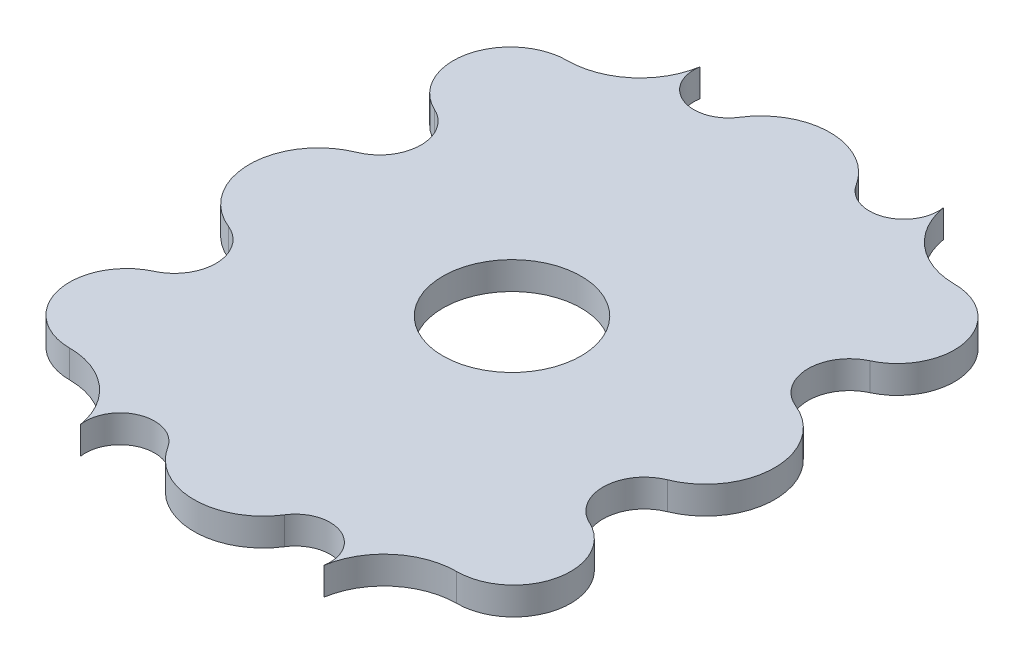
from build123d import *

# Parameters (mm, degrees)
SALIENTE_EXTRUIR1_DEPTH = 10
SALIENTE_EXTRUIR2_DEPTH = 10
CROQUIS3_R              = 25
CORTAR_EXTRUIR1_DEPTH   = 10


with BuildPart() as part:
    # Croquis1 → Saliente-Extruir1 (new body)
    with BuildSketch(Plane(origin=(0, 0, 0), x_dir=(1, 0, 0), z_dir=(0, 1, 0))):
        with BuildLine():
            Line((-70, -90), (-70, 90))
            ThreePointArc((-70, 90), (-52.983030462, 96.249658661), (-44.055908755, 112.027554074))
            ThreePointArc((-44.055908755, 112.027554074), (-36.156795126, 98.313355526), (-21.147629234, 103.333333333))
            ThreePointArc((-21.147629234, 103.333333333), (0, 115), (21.147629234, 103.333333333))
            ThreePointArc((21.147629234, 103.333333333), (36.156795126, 98.313355526), (44.055908755, 112.027554074))
            ThreePointArc((44.055908755, 112.027554074), (52.983030462, 96.249658661), (70, 90))
            Line((70, 90), (70, -90))
            ThreePointArc((70, -90), (52.983030462, -96.249658661), (44.055908755, -112.027554074))
            ThreePointArc((44.055908755, -112.027554074), (36.156795126, -98.313355526), (21.147629234, -103.333333333))
            ThreePointArc((21.147629234, -103.333333333), (0, -115), (-21.147629234, -103.333333333))
            ThreePointArc((-21.147629234, -103.333333333), (-36.156795126, -98.313355526), (-44.055908755, -112.027554074))
            ThreePointArc((-44.055908755, -112.027554074), (-52.983030462, -96.249658661), (-70, -90))
        make_face()
    extrude(amount=SALIENTE_EXTRUIR1_DEPTH)

    # Croquis2 → Saliente-Extruir2 (add)
    with BuildSketch(Plane(origin=(0, 10, 0), x_dir=(1, 0, 0), z_dir=(0, 1, 0))):
        with BuildLine():
            ThreePointArc((78.682594762, 50.68578538), (90.130790614, 73.830022537), (70, 90))
            Line((70, 90), (70, 37.080992462))
            ThreePointArc((70, 37.080992462), (72.355612347, 45.150655433), (78.682594762, 50.68578538))
        make_face()
        with BuildLine():
            ThreePointArc((78.682594762, -50.68578538), (72.355612347, -45.150655433), (70, -37.080992462))
            Line((70, -37.080992462), (70, -90))
            ThreePointArc((70, -90), (90.130790614, -73.830022537), (78.682594762, -50.68578538))
        make_face()
        with BuildLine():
            ThreePointArc((79.375, 23.175620272), (72.562657029, 28.695737531), (70, 37.080992462))
            Line((70, 37.080992462), (70, -37.080992462))
            ThreePointArc((70, -37.080992462), (72.562657029, -28.695737531), (79.375, -23.175620272))
            ThreePointArc((79.375, -23.175620272), (95, 0), (79.375, 23.175620272))
        make_face()
        with BuildLine():
            Line((-70, -90), (-70, -37.080992462))
            ThreePointArc((-70, -37.080992462), (-72.355612347, -45.150655433), (-78.682594762, -50.68578538))
            ThreePointArc((-78.682594762, -50.68578538), (-90.130790614, -73.830022537), (-70, -90))
        make_face()
        with BuildLine():
            Line((-70, -37.080992462), (-70, 37.080992435))
            ThreePointArc((-70, 37.080992435), (-72.562657036, 28.69573752), (-79.375, 23.175620272))
            ThreePointArc((-79.375, 23.175620272), (-95, 0), (-79.375, -23.175620272))
            ThreePointArc((-79.375, -23.175620272), (-72.562657029, -28.695737531), (-70, -37.080992462))
        make_face()
        with BuildLine():
            Line((-70, 37.080992435), (-70, 90))
            ThreePointArc((-70, 90), (-90.130790614, 73.830022537), (-78.682594762, 50.68578538))
            ThreePointArc((-78.682594762, 50.68578538), (-72.35561234, 45.150655422), (-70, 37.080992435))
        make_face()
    extrude(amount=-SALIENTE_EXTRUIR2_DEPTH)

    # Croquis3 → Cortar-Extruir1 (cut)
    with BuildSketch(Plane(origin=(0, 10, 0), x_dir=(1, 0, 0), z_dir=(0, 1, 0))):
        Circle(CROQUIS3_R)
    extrude(amount=-CORTAR_EXTRUIR1_DEPTH, mode=Mode.SUBTRACT)


solid = part.part
